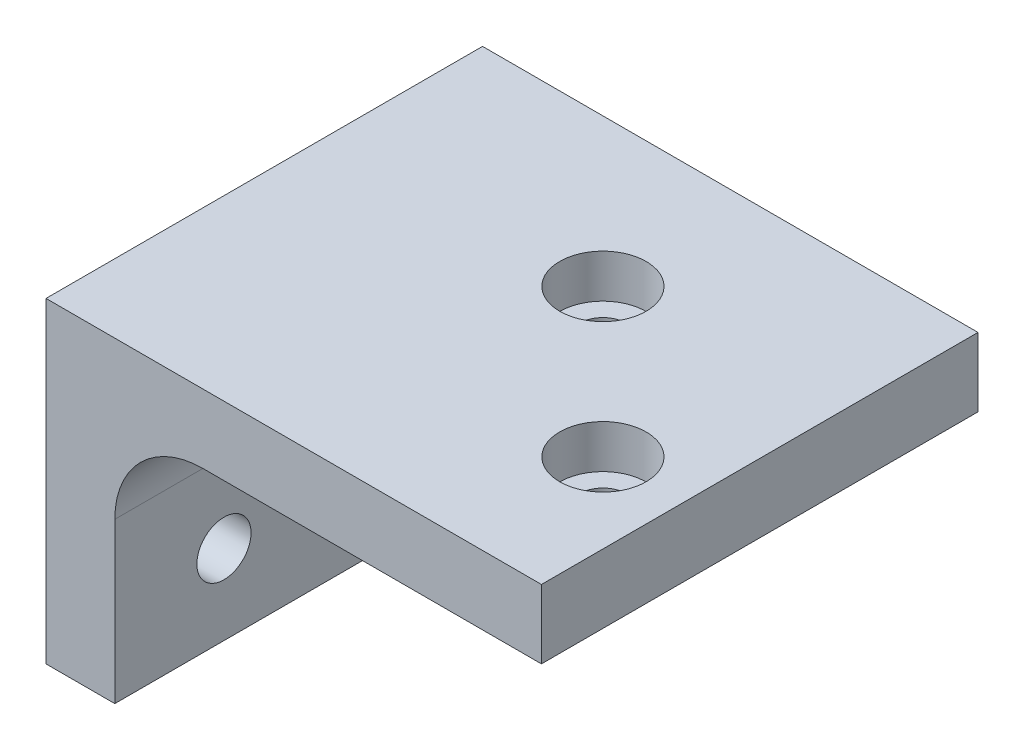
from build123d import *

# Parameters (mm, degrees)
BOSS_EXTRUDE1_DEPTH = 40.2844
SKETCH2_R           = 2.1336
CUT_EXTRUDE1_DEPTH  = 72.997408866
SKETCH3_R           = 3.9878
CUT_EXTRUDE2_DEPTH  = 4
SKETCH4_R           = 2.5
CUT_EXTRUDE3_DEPTH  = 138.863130215


with BuildPart() as part:
    # Sketch1 → Boss-Extrude1 (new body)
    with BuildSketch(Plane.XY):
        with BuildLine():
            Line((55.12, 125.830890045), (9.4, 125.830890045))
            Line((9.4, 125.830890045), (9.4, 96.620890045))
            Line((9.4, 96.620890045), (15.75, 96.620890045))
            Line((15.75, 96.620890045), (15.75, 111.352890045))
            ThreePointArc((15.75, 111.352890045), (18.130636083, 117.100253962), (23.878, 119.480890045))
            Line((23.878, 119.480890045), (55.12, 119.480890045))
            Line((55.12, 119.480890045), (55.12, 125.830890045))
        make_face()
    extrude(amount=-BOSS_EXTRUDE1_DEPTH)

    # Sketch2 → Cut-Extrude1 (cut, through all)
    with BuildSketch(Plane(origin=(0, 119.480890045, 0), x_dir=(-1, 0, 0), z_dir=(0, -1, 0))):
        with Locations((-47.756789836, 13.03483709)):
            Circle(SKETCH2_R)
        with Locations((-34.133741301, 26.657885626)):
            Circle(SKETCH2_R)
    extrude(amount=-CUT_EXTRUDE1_DEPTH, mode=Mode.SUBTRACT)

    # Sketch3 → Cut-Extrude2 (cut)
    with BuildSketch(Plane(origin=(0, 125.830890045, 0), x_dir=(1, 0, 0), z_dir=(0, 1, 0))):
        with Locations((47.756789836, 13.03483709)):
            Circle(SKETCH3_R)
        with Locations((34.133741301, 26.657885626)):
            Circle(SKETCH3_R)
    extrude(amount=-CUT_EXTRUDE2_DEPTH, mode=Mode.SUBTRACT)

    # Sketch4 → Cut-Extrude3 (cut, through all)
    with BuildSketch(Plane(origin=(15.75, 0, 0), x_dir=(0, 0, -1), z_dir=(1, 0, 0))):
        with Locations((10.0711, 103.986890045)):
            Circle(SKETCH4_R)
        with Locations((30.2133, 103.986890045)):
            Circle(SKETCH4_R)
    extrude(amount=-CUT_EXTRUDE3_DEPTH, mode=Mode.SUBTRACT)


solid = part.part
